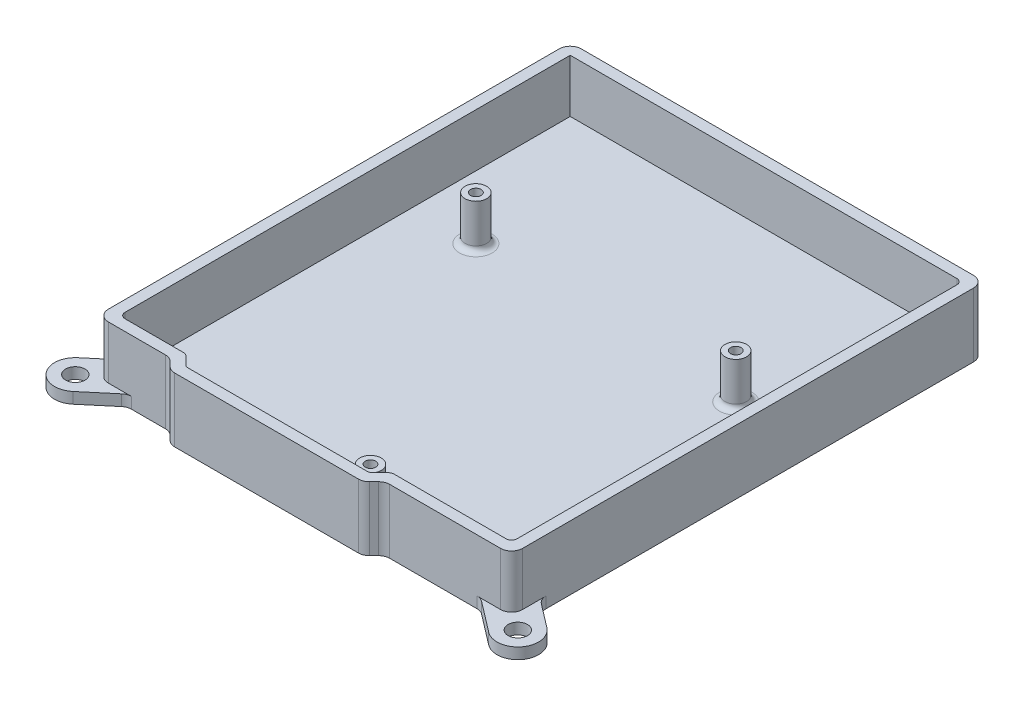
from build123d import *

# Parameters (mm, degrees)
CROQUIS2_R              = 1.75
SALIENTE_EXTRUIR1_DEPTH = 2
SALIENTE_EXTRUIR2_DEPTH = 9.58
CROQUIS4_R              = 1.95
CROQUIS4_R_2            = 0.95
SALIENTE_EXTRUIR3_DEPTH = 8
REDONDEO8_R             = 2
REDONDEO6_R             = 1
REDONDEO7_R             = 1


with BuildPart() as part:
    # Croquis2 → Saliente-Extruir1 (new body)
    with BuildSketch(Plane(origin=(0, 0, 0), x_dir=(1, 0, 0), z_dir=(0, 1, 0))):
        with BuildLine():
            Line((-2, 53.49999626), (-2, 3.219080693))
            Line((-2, 3.219080693), (-6.743568922, -0.784163489))
            ThreePointArc((-6.743568922, -0.784163489), (-7.190837741, -6.068569852), (-1.906431378, -6.515838671))
            Line((-1.906431378, -6.515838671), (3.444526745, -2))
            Line((3.444526745, -2), (11.171570195, -2))
            Line((11.171570195, -2), (13.171571275, -4.00000108))
            Line((13.171571275, -4.00000108), (48.035530736, -4.00000108))
            Line((48.035530736, -4.00000108), (50.035529276, -2))
            Line((50.035529276, -2), (67.338985587, -2))
            Line((67.338985587, -2), (73.398242548, -6.629745396))
            ThreePointArc((73.398242548, -6.629745396), (78.654744166, -5.926758382), (77.951757152, -0.670256764))
            Line((77.951757152, -0.670256764), (72.8979997, 3.191208502))
            Line((72.8979997, 3.191208502), (72.8979997, 78.186586384))
            Line((72.8979997, 78.186586384), (72.8979997, 83.499999105))
            Line((72.8979997, 83.499999105), (72.867896766, 83.499999104))
            Line((72.867896766, 83.499999104), (67.604355768, 83.499999003))
            Line((67.604355768, 83.499999003), (0, 83.499997702))
            Line((0, 83.499997702), (-2, 83.499997663))
            Line((-2, 83.499997663), (-2, 53.49999626))
        make_face()
        with Locations((-4.32500015, -3.65000108)):
            Circle(CROQUIS2_R, mode=Mode.SUBTRACT)
        with Locations((75.67499985, -3.65000108)):
            Circle(CROQUIS2_R, mode=Mode.SUBTRACT)
    extrude(amount=SALIENTE_EXTRUIR1_DEPTH)

    # Croquis3 → Saliente-Extruir2 (add)
    with BuildSketch(Plane(origin=(0, 2, 0), x_dir=(1, 0, 0), z_dir=(0, 1, 0))):
        Polygon((-2, 83.499997663), (72.8979997, 83.499999105), (72.8979997, -2), (50.035529276, -2), (48.035530736, -4.00000108), (13.171571275, -4.00000108), (11.171570195, -2), (-2, -2), (-2, 53.49999626), align=None)
        Polygon((70.8979997, 81.499999066), (70.8979997, 0), (49.207101407, 0), (47.207102867, -2.00000108), (13.9999984, -2.00000108), (11.99999732, 0), (0, 0), (0, 55.49999626), (0, 81.499997702), align=None, mode=Mode.SUBTRACT)
    extrude(amount=SALIENTE_EXTRUIR2_DEPTH)

    # Croquis4 → Saliente-Extruir3 (add)
    # profile 1 of 3: a face of its own
    with BuildSketch(Plane(origin=(0, 2, 0), x_dir=(1, 0, 0), z_dir=(0, 1, 0))):
        with Locations((11.36999858, 53.069999)):
            Circle(CROQUIS4_R)
        with Locations((11.36999858, 53.069999)):
            Circle(CROQUIS4_R_2, mode=Mode.SUBTRACT)
    # profile 2 of 3: a face of its own
    with BuildSketch(Plane(origin=(0, 2, 0), x_dir=(1, 0, 0), z_dir=(0, 1, 0))):
        with Locations((59.62999858, 51.799999)):
            Circle(CROQUIS4_R)
        with Locations((59.62999858, 51.799999)):
            Circle(CROQUIS4_R_2, mode=Mode.SUBTRACT)
    # profile 3 of 3: a face of its own
    with BuildSketch(Plane(origin=(0, 2, 0), x_dir=(1, 0, 0), z_dir=(0, 1, 0))):
        with Locations((44.38999858, 0.999999)):
            Circle(CROQUIS4_R)
        with Locations((44.38999858, 0.999999)):
            Circle(CROQUIS4_R_2, mode=Mode.SUBTRACT)
    extrude(amount=SALIENTE_EXTRUIR3_DEPTH)

    # Redondeo8
    redondeo8_edges = [part.edges().sort_by_distance(p)[0] for p in [
        (72.8979997, 6.79, 2),
        (-2, 1, -3.219080693),
        (-2, 6.79, 2),
        (3.444526745, 1, 2),
        (11.171570195, 5.79, 2),
        (13.171571275, 5.79, 4.00000108),
        (50.035529276, 5.79, 2),
        (48.035530736, 5.79, 4.00000108),
        (72.8979997, 5.79, -83.499999105),
        (72.8979997, 1, -3.191208502),
        (67.338985587, 1, 2),
        (-2, 5.79, -83.499997663),
    ]]
    fillet(redondeo8_edges, radius=REDONDEO8_R)

    # Redondeo6
    redondeo6_edges = [part.edges().sort_by_distance(p)[0] for p in [
        (70.8979997, 6.79, -81.499999066),
        (70.8979997, 6.79, 0),
        (49.207101407, 6.79, 0),
        (47.207102867, 6.79, 2.00000108),
        (13.9999984, 6.79, 2.00000108),
        (11.99999732, 6.79, 0),
        (0, 6.79, 0),
    ]]
    fillet(redondeo6_edges, radius=REDONDEO6_R)

    # Redondeo7
    redondeo7_edges = [part.edges().sort_by_distance(p)[0] for p in [
        (42.43999858, 2, -0.999999),
        (57.67999858, 2, -51.799999),
        (9.41999858, 2, -53.069999),
    ]]
    fillet(redondeo7_edges, radius=REDONDEO7_R)


solid = part.part
